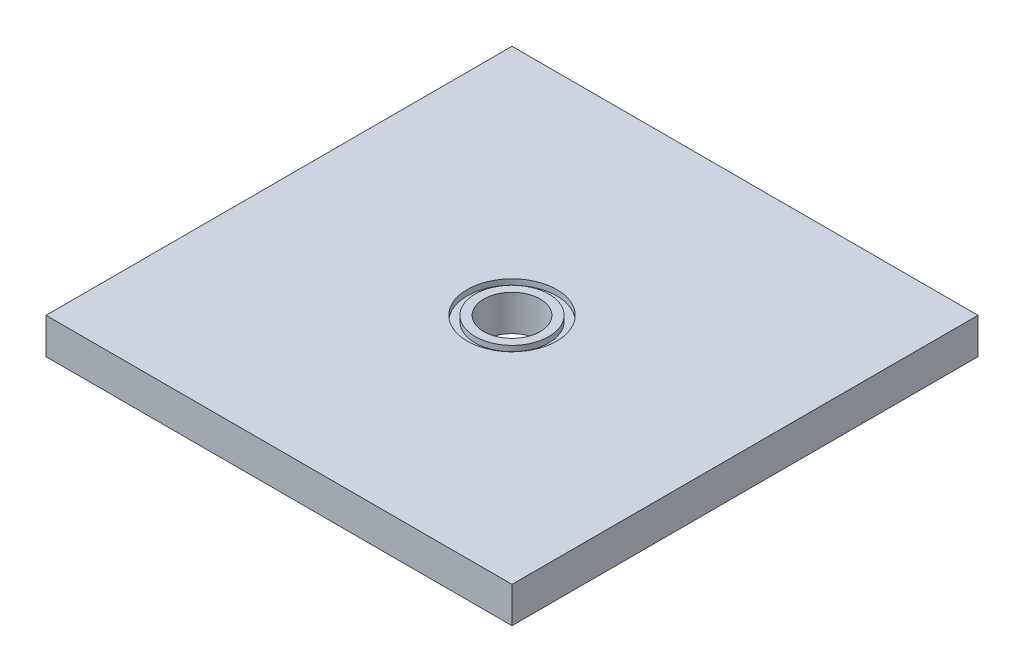
from build123d import *

# Parameters (mm, degrees)
SKETCH1_W           = 82.55
SKETCH1_H           = 82.55
BOSS_EXTRUDE1_DEPTH = 6.35
CUT_EXTRUDE1_REACH  = 60.716
SKETCH2_R           = 4.99999
SKETCH4_R           = 7.9248
SKETCH4_R_2         = 6.5278
CUT_EXTRUDE3_DEPTH  = 0.9779


with BuildPart() as part:
    # Sketch1 → Boss-Extrude1 (new body)
    with BuildSketch(Plane(origin=(0, 0, 0), x_dir=(1, 0, 0), z_dir=(0, 1, 0))):
        Rectangle(SKETCH1_W, SKETCH1_H)
    extrude(amount=BOSS_EXTRUDE1_DEPTH)

    # Sketch2 → Cut-Extrude1 (cut, up to next)
    with BuildSketch(Plane(origin=(0, 6.35, 0), x_dir=(1, 0, 0), z_dir=(0, 1, 0)), mode=Mode.PRIVATE) as cut_extrude1_sk1:
        Circle(SKETCH2_R)
    cut_extrude1_tool1 = extrude(cut_extrude1_sk1.sketch, amount=-CUT_EXTRUDE1_REACH, mode=Mode.PRIVATE) & part.part
    add(cut_extrude1_tool1.solids().sort_by_distance((0, 6.35, 0))[0], mode=Mode.SUBTRACT)

    # Sketch4 → Cut-Extrude3 (cut)
    with BuildSketch(Plane(origin=(0, 6.35, 0), x_dir=(1, 0, 0), z_dir=(0, 1, 0))):
        Circle(SKETCH4_R)
        Circle(SKETCH4_R_2, mode=Mode.SUBTRACT)
    extrude(amount=-CUT_EXTRUDE3_DEPTH, mode=Mode.SUBTRACT)


solid = part.part
